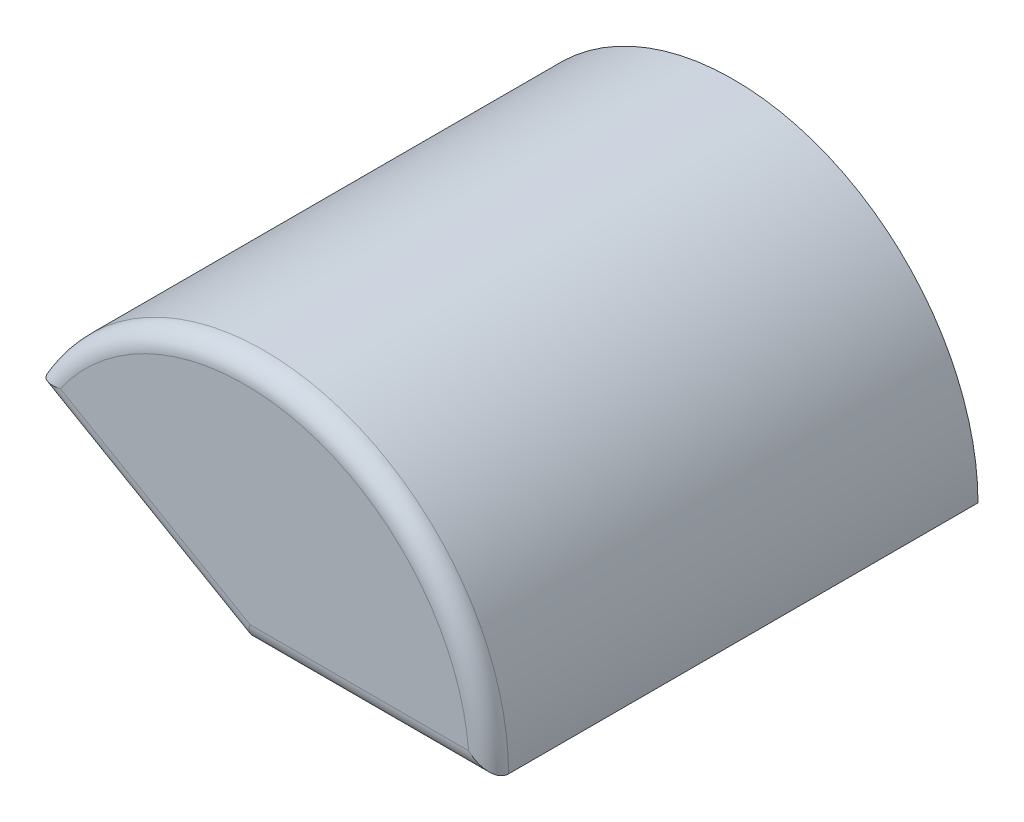
from build123d import *

# Parameters (mm, degrees)
BOSS_EXTRUDE1_DEPTH = 50
FILLET1_R           = 2


with BuildPart() as part:
    # Sketch1 → Boss-Extrude1 (new body)
    with BuildSketch(Plane.XY):
        with BuildLine():
            Line((-21.65063509461095, 12.500000000000025), (0, 0))
            Line((0, 0), (25, 0))
            ThreePointArc((25, 0), (6.470476127563035, 24.148145657226703), (-21.65063509461095, 12.500000000000025))
        make_face()
    extrude(amount=BOSS_EXTRUDE1_DEPTH)

    # Fillet1
    fillet1_edges = [part.edges().sort_by_distance(p)[0] for p in [
        (-10.825317547305476, 6.250000000000012, 50),
        (6.470476127563035, 24.148145657226713, 50),
        (12.5, 0, 50),
    ]]
    fillet(fillet1_edges, radius=FILLET1_R)


solid = part.part
